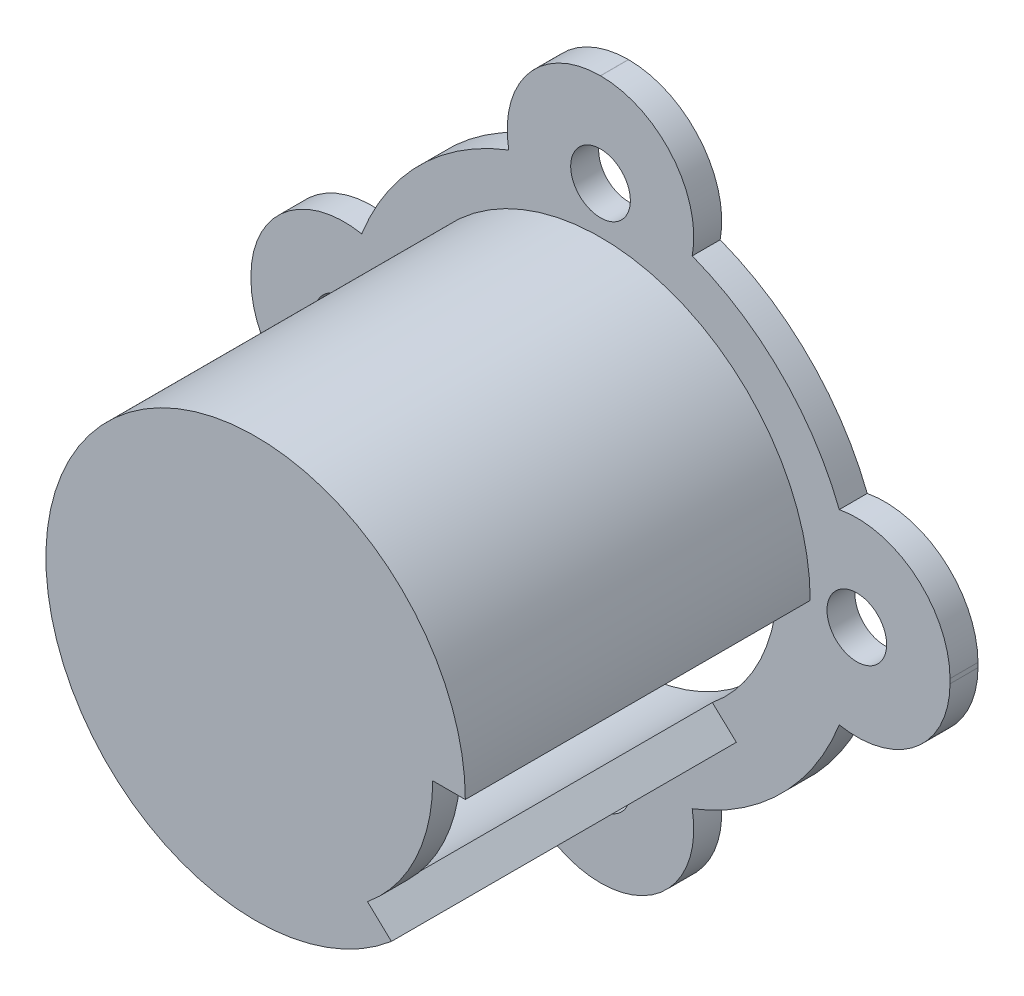
from build123d import *

# Parameters (mm, degrees)
ESQUISSE1_R                  = 22.5
BOSS_EXTRU_1_DEPTH           = 37
ENL_V_MAT_EXTRU_1_DEPTH      = 3
ENL_V_MAT_EXTRU_1_DEPTH_BACK = 34
ESQUISSE4_R                  = 19
ENL_V_MAT_EXTRU_3_DEPTH      = 49.80061475
ESQUISSE9_R                  = 37.5
BOSS_EXTRU_2_DEPTH           = 3
ENL_V_START                  = 3
ESQUISSE4_2_R                = 19
ENL_V_MAT_EXTRU_4_DEPTH      = 3
D_GAGEMENT_M61_D             = 6.4
ENL_V_START_2                = -3
ENL_V_MAT_EXTRU_5_DEPTH      = 3
CONG_1_R                     = 10
CONG_1_OF_SYM_TRIE4_R        = 10
SYM_TRIE5_START              = -3
SYM_TRIE5_DEPTH              = 3


# Read off the part's stored shape, not the designer's step: Symétrie5
with BuildPart() as part:
    # Esquisse1 → Boss.-Extru.1 (new body)
    with BuildSketch(Plane.XY):
        Circle(ESQUISSE1_R)
    extrude(amount=BOSS_EXTRU_1_DEPTH)

    # Esquisse4 → Enlèv. mat.-Extru.1 (cut, two sides: drawn at the far end of the back side and taken through both)
    with BuildSketch(Plane(origin=(0, 0, 0), x_dir=(-1, 0, 0), z_dir=(0, 0, -1)).offset(-ENL_V_MAT_EXTRU_1_DEPTH_BACK)):
        with Locations(Location((0, 0, 0), (0, 0, 180))):
            Circle(ESQUISSE4_R)
    extrude(amount=ENL_V_MAT_EXTRU_1_DEPTH + ENL_V_MAT_EXTRU_1_DEPTH_BACK, mode=Mode.SUBTRACT)

    # Esquisse7 → Enlèv. mat.-Extru.3 (cut, through all)
    with BuildSketch(Plane(origin=(0, 0, 0), x_dir=(-1, 0, 0), z_dir=(0, 0, -1))):
        with BuildLine():
            Line((-14.573529274, -17.142410697), (-11.999578126, -14.731263517))
            ThreePointArc((-11.999578126, -14.731263517), (-17.160885531, -8.154998946), (-19, 0))
            Line((-19, 0), (-22.5, 0))
            ThreePointArc((-22.5, 0), (-20.422468125, -9.443134843), (-14.573529274, -17.142410697))
        make_face()
    extrude(amount=-ENL_V_MAT_EXTRU_3_DEPTH, mode=Mode.SUBTRACT)

    # Esquisse9 → Boss.-Extru.2 (add)
    with BuildSketch(Plane(origin=(0, 0, 0), x_dir=(-1, 0, 0), z_dir=(0, 0, -1))):
        Circle(ESQUISSE9_R)
    extrude(amount=BOSS_EXTRU_2_DEPTH)

    # Esquisse4<2> → Enlèv. mat.-Extru.4 (cut)
    with BuildSketch(Plane(origin=(0, 0, 0), x_dir=(-1, 0, 0), z_dir=(0, 0, -1)).offset(ENL_V_START)):
        with Locations(Location((0, 0, 0), (0, 0, 180))):
            Circle(ESQUISSE4_2_R)
    extrude(amount=-ENL_V_MAT_EXTRU_4_DEPTH, mode=Mode.SUBTRACT)

    # Dégagement M61 (through all)
    with Locations(Plane(origin=(0, 0, -3), x_dir=(-1, 0, 0), z_dir=(0, 0, -1))):
        with Locations((0, 27.5), (27.5, 0), (0, -27.5), (-27.5, 0)):
            Hole(D_GAGEMENT_M61_D / 2)

    # Esquisse15 → Enlèv. mat.-Extru.5 (cut)
    with BuildSketch(Plane(origin=(0, 0, -3), x_dir=(-1, 0, 0), z_dir=(0, 0, -1)).offset(ENL_V_START_2)):
        with BuildLine():
            Line((34.932786702, 13.636363636), (25.617376915, 10))
            ThreePointArc((25.617376915, 10), (19.384796538, 19.505887911), (9.840281362, 25.679152297))
            Line((9.840281362, 25.679152297), (12.051640076, 35.51067405))
            ThreePointArc((12.051640076, 35.51067405), (25.913422274, 27.106171734), (34.932786702, 13.636363636))
        make_face()
    enl_v_mat_extru_5 = extrude(amount=ENL_V_MAT_EXTRU_5_DEPTH, mode=Mode.SUBTRACT)

    # Congé1
    # the kernel refuses this fillet: 10 mm, written as the material it takes off along each edge
    with BuildSketch(Plane(origin=(-12.051640076, 35.51067405, 30.511737931), x_dir=(0.9866266204606564, 0.16299666192405335, 0), z_dir=(0, 0, -1))) as cong_1_piece_1:
        with BuildLine():
            CenterArc((10.577402483, 9.866707582), CONG_1_R, 178.889666711, 100.475681696)
            Line((0.579280147, 10.060485169), (0.3793177, 10.064360721))
            ThreePointArc((0.3793177, 10.064360721), (0.089970794, 5.04173949), (-0.199669279, 0.011496906))
            Line((-0.199669279, 0.011496906), (-0.032545854, -0.197334152))
            ThreePointArc((-0.032545854, -0.197334152), (6.102347586, -0.699846569), (12.237241026, -0.197334152))
            Line((12.237241026, -0.197334152), (12.204695172, 0))
        make_face()
    extrude(amount=64.023475862, mode=Mode.SUBTRACT)
    with BuildSketch(Plane(origin=(-34.932786702, 13.636363636, 34.090909091), x_dir=(-0.18820424606330075, -0.9821299108385533, 0), z_dir=(0, 0, -1))) as cong_1_piece_2:
        with BuildLine():
            CenterArc((11.818181818, -9.83332166), CONG_1_R, 79.524318304, 100.475681696)
            Line((1.818181818, -9.83332166), (1.618181818, -9.83332166))
            ThreePointArc((1.618181818, -9.83332166), (0.712424476, -4.953024467), (-0.196666433, -0.036363636))
            Line((-0.196666433, -0.036363636), (-0.036363636, 0.196666433))
            ThreePointArc((-0.036363636, 0.196666433), (6.818181818, 0.825043774), (13.672727273, 0.196666433))
            Line((13.672727273, 0.196666433), (13.636363636, 0))
        make_face()
    extrude(amount=71.181818182, mode=Mode.SUBTRACT)

    # Symétrie4: Enlèv. mat.-Extru.5 across plane
    add(enl_v_mat_extru_5.mirror(Plane(origin=(0, 0, 0), x_dir=(0, 0, 1), z_dir=(1, 0, 0))), mode=Mode.SUBTRACT)

    # Congé1 of Symétrie4
    # the kernel refuses this fillet: 10 mm, written as the material it takes off along each edge
    with BuildSketch(Plane(origin=(12.051640076, 35.51067405, 30.511737931), x_dir=(-0.9866266204606562, 0.1629966619240532, 0), z_dir=(0, 0, -1))) as cong_1_of_sym_trie4_piece_1:
        with BuildLine():
            CenterArc((10.577402483, -9.866707582), CONG_1_OF_SYM_TRIE4_R, 80.634651593, 100.475681696)
            Line((0.579280147, -10.060485169), (0.3793177, -10.064360721))
            ThreePointArc((0.3793177, -10.064360721), (0.089970794, -5.04173949), (-0.199669279, -0.011496906))
            Line((-0.199669279, -0.011496906), (-0.032545854, 0.197334152))
            ThreePointArc((-0.032545854, 0.197334152), (6.102347586, 0.699846569), (12.237241026, 0.197334152))
            Line((12.237241026, 0.197334152), (12.204695172, 0))
        make_face()
    extrude(amount=64.023475862, mode=Mode.SUBTRACT)
    with BuildSketch(Plane(origin=(34.932786702, 13.636363636, 34.090909091), x_dir=(0.18820424606330144, -0.982129910838553, 0), z_dir=(0, 0, -1))) as cong_1_of_sym_trie4_piece_2:
        with BuildLine():
            CenterArc((11.818181818, 9.83332166), CONG_1_OF_SYM_TRIE4_R, 180, 100.475681696)
            Line((1.818181818, 9.83332166), (1.618181818, 9.83332166))
            ThreePointArc((1.618181818, 9.83332166), (0.712424476, 4.953024467), (-0.196666433, 0.036363636))
            Line((-0.196666433, 0.036363636), (-0.036363636, -0.196666433))
            ThreePointArc((-0.036363636, -0.196666433), (6.818181818, -0.825043774), (13.672727273, -0.196666433))
            Line((13.672727273, -0.196666433), (13.636363636, 0))
        make_face()
    extrude(amount=71.181818182, mode=Mode.SUBTRACT)

    # Symétrie5 outline → Symétrie5 (cut)
    with BuildSketch(Plane.XY.offset(SYM_TRIE5_START)):
        with BuildLine():
            ThreePointArc((-0.010162924, -37.499998623), (-7.696247071, -33.893936965), (-9.840281362, -25.679152297))
            ThreePointArc((-9.840281362, -25.679152297), (-19.384796538, -19.505887911), (-25.617376915, -10))
            ThreePointArc((-25.617376915, -10), (-33.845353653, -7.907162456), (-37.499208239, -0.243683034))
            ThreePointArc((-37.499208239, -0.243683034), (-26.433813461, -26.59893806), (-0.010162924, -37.499998623))
        make_face()
        with BuildLine():
            ThreePointArc((9.840281362, -25.679152297), (7.696247071, -33.893936965), (0.010162924, -37.499998623))
            ThreePointArc((0.010162924, -37.499998623), (26.433813461, -26.59893806), (37.499208239, -0.243683034))
            ThreePointArc((37.499208239, -0.243683034), (33.845353653, -7.907162456), (25.617376915, -10))
            ThreePointArc((25.617376915, -10), (19.384796538, -19.505887911), (9.840281362, -25.679152297))
        make_face()
    extrude(amount=SYM_TRIE5_DEPTH, mode=Mode.SUBTRACT)


solid = part.part
